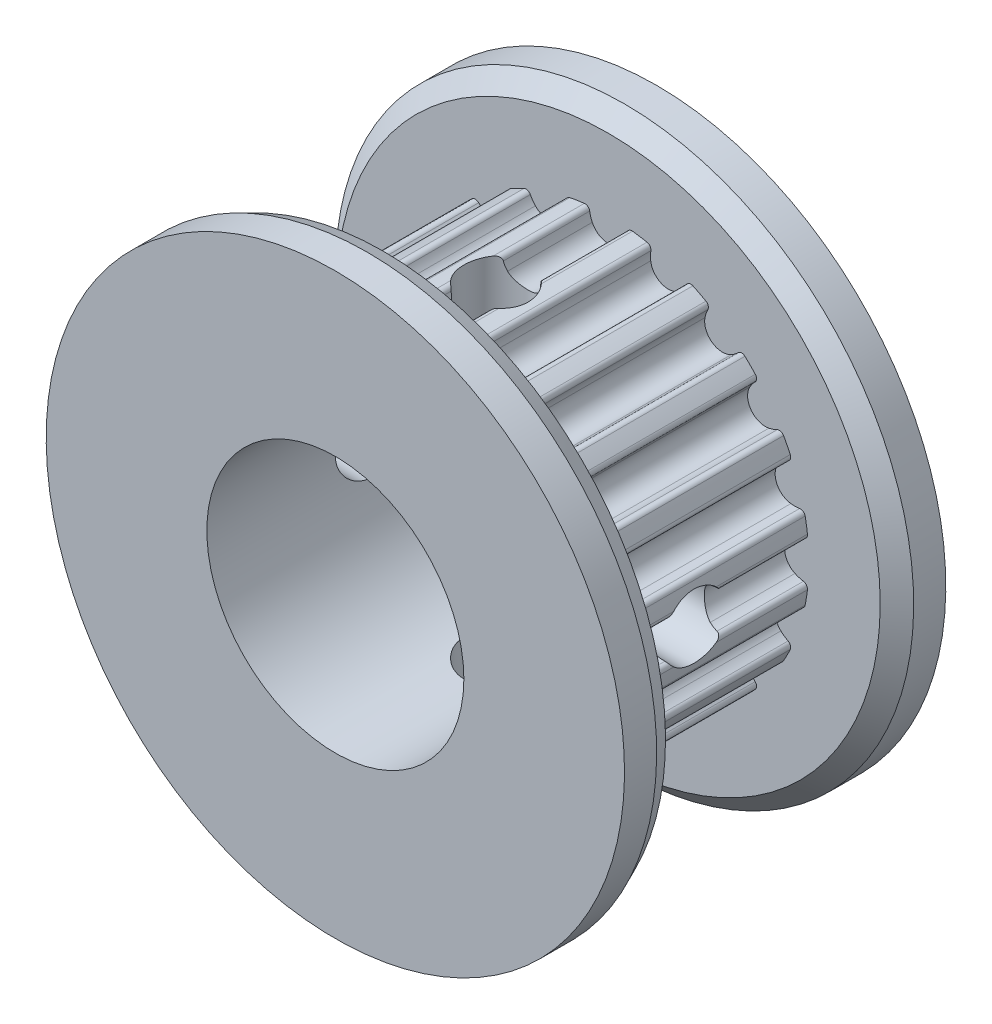
from build123d import *

# Parameters (mm, degrees)
CROQUIS1_R                 = 6.366
SALIENTE_EXTRUIR1_DEPTH    = 7
CORTAR_EXTRUIR1_DEPTH      = 12.404030516
MATRIZC1_COUNT             = 20
CROQUIS6_R                 = 4
CORTAR_EXTRUIR2_DEPTH      = 17.186414056
CORTAR_EXTRUIR3_DEPTH      = 16.305227865
CORTAR_EXTRUIR3_DEPTH_BACK = 16.305227865
CROQUIS7_R                 = 1
CORTAR_EXTRUIR4_DEPTH      = 16.305227921
CORTAR_EXTRUIR4_DEPTH_BACK = 16.305227921
CROQUIS8_R                 = 1


with BuildPart() as part:
    # Croquis1 → Saliente-Extruir1 (new body)
    with BuildSketch(Plane.XY):
        Circle(CROQUIS1_R)
    extrude(amount=SALIENTE_EXTRUIR1_DEPTH)

    # Croquis3 → Cortar-Extruir1 (cut, through all)
    with BuildSketch(Plane(origin=(0, 0, 0), x_dir=(-1, 0, 0), z_dir=(0, 0, -1))):
        with BuildLine():
            ThreePointArc((0.749845546, 6.193775315), (0.863064611, 6.179016142), (0.975994627, 6.162187557))
            Line((0.975994627, 6.162187557), (0.995861804, 6.287623976))
            ThreePointArc((0.995861804, 6.287623976), (0, 6.366), (-0.995861804, 6.287623976))
            Line((-0.995861804, 6.287623976), (-0.975994627, 6.162187557))
            ThreePointArc((-0.975994627, 6.162187557), (-0.863064611, 6.179016142), (-0.749845546, 6.193775315))
            ThreePointArc((-0.749845546, 6.193775315), (-0.641504612, 6.164627299), (-0.583688192, 6.068478318))
            ThreePointArc((-0.583688192, 6.068478318), (-0.55273127, 5.93441999), (-0.503666473, 5.805879678))
            ThreePointArc((-0.503666473, 5.805879678), (0, 5.484), (0.503666473, 5.805879678))
            ThreePointArc((0.503666473, 5.805879678), (0.55273127, 5.93441999), (0.583688192, 6.068478318))
            ThreePointArc((0.583688192, 6.068478318), (0.641504612, 6.164627299), (0.749845546, 6.193775315))
        make_face()
    cortar_extruir1 = extrude(amount=-CORTAR_EXTRUIR1_DEPTH, mode=Mode.SUBTRACT)

    # MatrizC1: Cortar-Extruir1 ×20 about axis
    matrizc1_axis = Axis((0, 0, 7), (0, 0, -1))
    for i in range(1, MATRIZC1_COUNT):
        add(cortar_extruir1.rotate(matrizc1_axis, i * 360 / MATRIZC1_COUNT), mode=Mode.SUBTRACT)

    # Croquis5 → Revolución1 (revolve)
    with BuildSketch(Plane(origin=(0, 0, 0), x_dir=(0, 0, -1), z_dir=(1, 0, 0))):
        Polygon((0, 0), (1.5, 0), (1.5, 9), (0.5, 9), (0, 8.458311378), align=None)
        Polygon((-7, 0), (-8.5, 0), (-8.5, 9), (-7.5, 9), (-7, 8.776025475), align=None)
    revolve(axis=Axis((0, 0, 7), (0, 0, 1)))

    # Croquis6 → Cortar-Extruir2 (cut, through all)
    with BuildSketch(Plane.XY.offset(8.5)):
        Circle(CROQUIS6_R)
    extrude(amount=-CORTAR_EXTRUIR2_DEPTH, mode=Mode.SUBTRACT)

    # Croquis7 → Cortar-Extruir3 (cut, two sides: drawn at the far end of the back side and taken through both)
    with BuildSketch(Plane(origin=(0, 0, 0), x_dir=(0, 0, -1), z_dir=(1, 0, 0)).offset(-CORTAR_EXTRUIR3_DEPTH_BACK)):
        with Locations((-3.5, 0)):
            Circle(CROQUIS7_R)
    extrude(amount=CORTAR_EXTRUIR3_DEPTH + CORTAR_EXTRUIR3_DEPTH_BACK, mode=Mode.SUBTRACT)

    # Croquis8 → Cortar-Extruir4 (cut, two sides: drawn at the far end of the back side and taken through both)
    with BuildSketch(Plane(origin=(0, 0, 0), x_dir=(1, 0, 0), z_dir=(0, 1, 0)).offset(-CORTAR_EXTRUIR4_DEPTH_BACK)):
        with Locations((0, -3.5)):
            Circle(CROQUIS8_R)
    extrude(amount=CORTAR_EXTRUIR4_DEPTH + CORTAR_EXTRUIR4_DEPTH_BACK, mode=Mode.SUBTRACT)


solid = part.part
